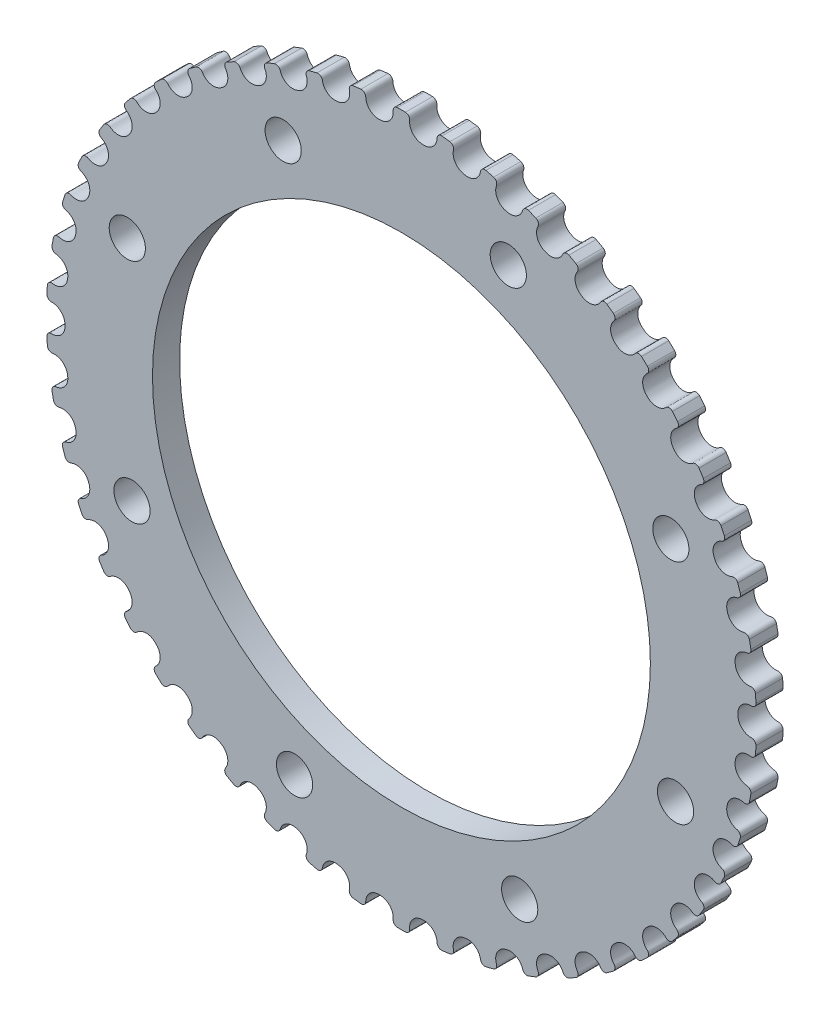
from build123d import *

# Parameters (mm, degrees)
SKETCHREVOLVEGEARBELT01_W       = 3
SKETCHREVOLVEGEARBELT01_H       = 39.217218411
TOOTHEXTRUDECUTGEARBELT01_DEPTH = 7.238999891
PATTERNGEARBELT01_COUNT         = 50
BOREREVOLVESKETCH_W             = 14.477999782
BOREREVOLVESKETCH_H             = 27.5
SKETCH1_R                       = 2
CUT_EXTRUDE1_DEPTH              = 10


with BuildPart() as part:
    # SketchRevolveGearBelt01 → GearBelt01 (revolve)
    with BuildSketch(Plane(origin=(0, 0, 0), x_dir=(0, 0, -1), z_dir=(1, 0, 0))):
        with Locations((0, 19.608609206)):
            Rectangle(SKETCHREVOLVEGEARBELT01_W, SKETCHREVOLVEGEARBELT01_H)
    revolve(axis=Axis((0, 0, 0), (0, 0, -1)))

    # SketchToothGearBelt01 → ToothExtrudeCutGearBelt01 (cut, symmetric)
    with BuildSketch(Plane.XY):
        with BuildLine():
            ThreePointArc((39.164679022, 2.032334243), (39.217374535, 0), (39.164679022, -2.032334243))
            add(Edge.make_bspline(
                [(39.164679022, -2.032334243), (39.166048883, -2.005984565), (39.164883295, -1.966294001), (39.156943231, -1.91408071), (39.147835553, -1.875531869), (39.135634795, -1.83784758), (39.12042125, -1.801275572), (39.102294908, -1.766056265), (39.081374934, -1.732421187), (39.057798852, -1.700591449), (39.031721649, -1.670776298), (39.003314752, -1.64317173), (38.972764904, -1.617959231), (38.940272938, -1.59530448), (38.906052449, -1.575356646), (38.870328405, -1.558245974), (38.833335623, -1.544088262), (38.795317397, -1.532964211), (38.756523252, -1.524993116), (38.717209712, -1.520055082), (38.66580266, -1.5184582), (38.589994052, -1.519756698), (38.489697952, -1.516042965), (38.377509936, -1.502613699), (38.266707897, -1.480535762), (38.157982142, -1.449806634), (38.052000418, -1.410652745), (37.949416183, -1.363305357), (37.850861265, -1.308058822), (37.756942857, -1.245252774), (37.668239537, -1.175274325), (37.585297771, -1.098554529), (37.50862852, -1.015566038), (37.43870413, -0.926820101), (37.375955295, -0.832863447), (37.320768875, -0.73427489), (37.27348376, -0.631661826), (37.234395318, -0.525656278), (37.203729181, -0.416911781), (37.181730901, -0.306096466), (37.168324647, -0.193899714), (37.165224472, -0.105119728), (37.165512565, -0.040500395), (37.16545238, 0), (37.165512565, 0.040500395), (37.165224472, 0.105119728), (37.168324647, 0.193899714), (37.181730901, 0.306096466), (37.203729181, 0.416911781), (37.234395318, 0.525656278), (37.27348376, 0.631661826), (37.320768875, 0.73427489), (37.375955295, 0.832863447), (37.43870413, 0.926820101), (37.50862852, 1.015566038), (37.585297771, 1.098554529), (37.668239537, 1.175274325), (37.756942857, 1.245252774), (37.850861265, 1.308058822), (37.949416183, 1.363305357), (38.052000418, 1.410652745), (38.157982142, 1.449806634), (38.266707897, 1.480535762), (38.377509936, 1.502613699), (38.489697952, 1.516042965), (38.589994052, 1.519756698), (38.66580266, 1.5184582), (38.717209712, 1.520055082), (38.756523252, 1.524993116), (38.795317397, 1.532964211), (38.833335623, 1.544088262), (38.870328405, 1.558245974), (38.906052449, 1.575356646), (38.940272938, 1.59530448), (38.972764904, 1.617959231), (39.003314752, 1.64317173), (39.031721649, 1.670776298), (39.057798852, 1.700591449), (39.081374934, 1.732421187), (39.102294908, 1.766056265), (39.12042125, 1.801275572), (39.135634795, 1.83784758), (39.147835553, 1.875531869), (39.156943231, 1.91408071), (39.164883295, 1.966294001), (39.166048883, 2.005984565), (39.164679022, 2.032334243)],
                knots=[0, 0, 0, 0, 0.012346399, 0.018519598, 0.024692797, 0.030865997, 0.037039196, 0.043212395, 0.049385595, 0.055558794, 0.061731993, 0.067905193, 0.074078392, 0.080251591, 0.086424791, 0.09259799, 0.09877119, 0.104944389, 0.111117588, 0.117290788, 0.123463987, 0.135171051, 0.152780618, 0.170390185, 0.187999752, 0.205609319, 0.223218886, 0.240828453, 0.25843802, 0.276047587, 0.293657154, 0.311266721, 0.328876288, 0.346485855, 0.364095422, 0.381704989, 0.399314555, 0.416924122, 0.434533689, 0.452143256, 0.469752823, 0.48736239, 0.493681195, 0.5, 0.506318805, 0.51263761, 0.530247177, 0.547856744, 0.565466311, 0.583075878, 0.600685445, 0.618295011, 0.635904578, 0.653514145, 0.671123712, 0.688733279, 0.706342846, 0.723952413, 0.74156198, 0.759171547, 0.776781114, 0.794390681, 0.812000248, 0.829609815, 0.847219382, 0.864828949, 0.876536013, 0.882709212, 0.888882412, 0.895055611, 0.90122881, 0.90740201, 0.913575209, 0.919748409, 0.925921608, 0.932094807, 0.938268007, 0.944441206, 0.950614405, 0.956787605, 0.962960804, 0.969134003, 0.975307203, 0.981480402, 0.987653601, 1, 1, 1, 1], degree=3))
        make_face()
    toothextrudecutgearbelt01 = extrude(amount=TOOTHEXTRUDECUTGEARBELT01_DEPTH, both=True, mode=Mode.SUBTRACT)

    # PatternGearBelt01: ToothExtrudeCutGearBelt01 ×50 about axis
    patterngearbelt01_axis = Axis((0, 0, 55), (0, 0, -1))
    for i in range(1, PATTERNGEARBELT01_COUNT):
        add(toothextrudecutgearbelt01.rotate(patterngearbelt01_axis, i * 360 / PATTERNGEARBELT01_COUNT), mode=Mode.SUBTRACT)

    # BoreRevolveSketch → BoreRevolveCut (revolve, cut)
    with BuildSketch(Plane(origin=(0, 0, 0), x_dir=(0, 0, -1), z_dir=(1, 0, 0))):
        with Locations((0, 13.75)):
            Rectangle(BOREREVOLVESKETCH_W, BOREREVOLVESKETCH_H)
    revolve(axis=Axis((0, 0, 0), (0, 0, -1)), mode=Mode.SUBTRACT)

    # Sketch1 → Cut-Extrude1 (cut)
    with BuildSketch(Plane.XY.offset(1.5)):
        with Locations((-29.75888379, -13.063645569)):
            Circle(SKETCH1_R)
        with Locations((-11.80531616, -30.280100897)):
            Circle(SKETCH1_R)
        with Locations((13.063645569, -29.75888379)):
            Circle(SKETCH1_R)
        with Locations((30.280100897, -11.80531616)):
            Circle(SKETCH1_R)
        with Locations((29.75888379, 13.063645569)):
            Circle(SKETCH1_R)
        with Locations((11.80531616, 30.280100897)):
            Circle(SKETCH1_R)
        with Locations((-13.063645569, 29.75888379)):
            Circle(SKETCH1_R)
        with Locations((-30.280100897, 11.80531616)):
            Circle(SKETCH1_R)
    extrude(amount=-CUT_EXTRUDE1_DEPTH, mode=Mode.SUBTRACT)


solid = part.part
